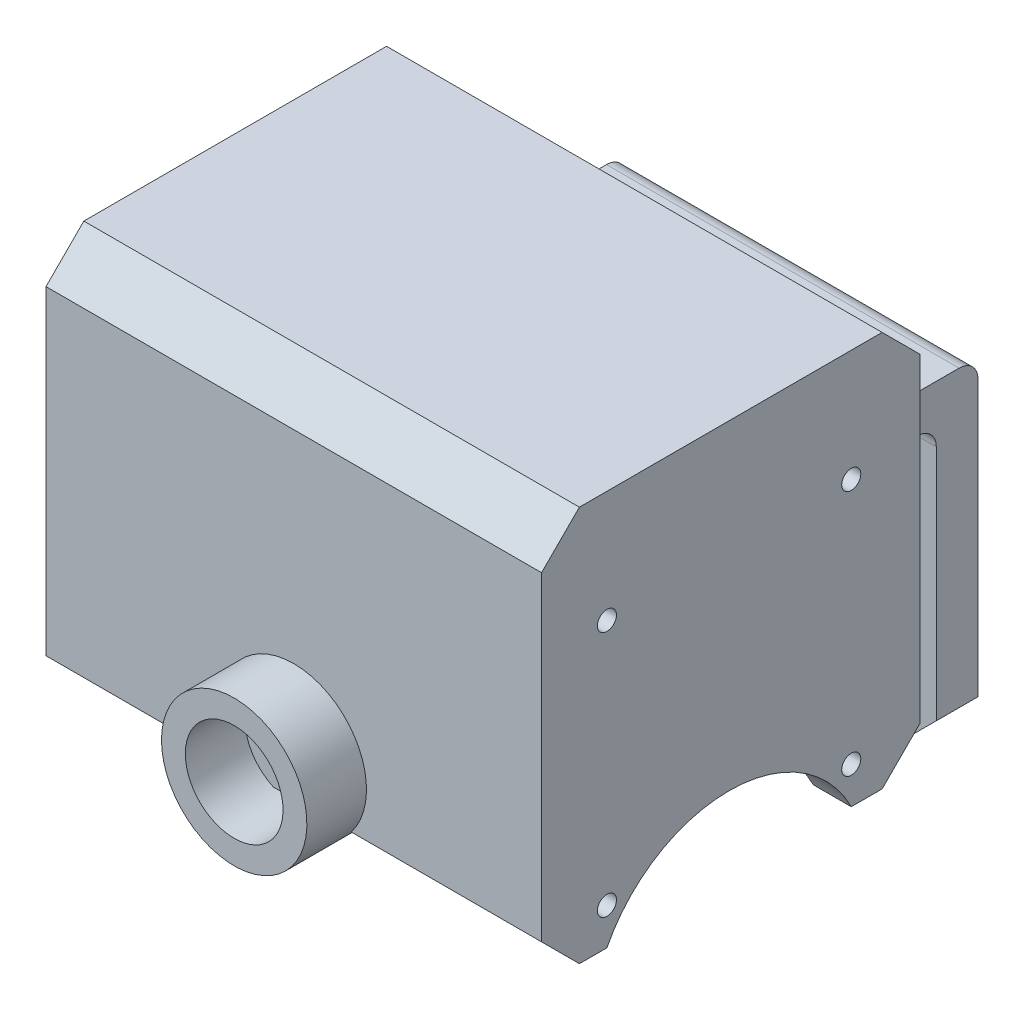
from build123d import *

# Parameters (mm, degrees)
SKETCH1_W                       = 25
SKETCH1_H                       = 30
BOSS_EXTRUDE1_DEPTH             = 3.175
SKETCH2_W                       = 25
SKETCH2_H                       = 3.175
BOSS_EXTRUDE2_DEPTH             = 41.58
SKETCH3_W                       = 3.175
SKETCH3_H                       = 25
BOSS_EXTRUDE3_DEPTH             = 30
CUT_EXTRUDE1_REACH              = 60.775
SKETCH4_R                       = 11.5
CUT_EXTRUDE2_REACH              = 60.775
SKETCH5_R                       = 0.8
CUT_EXTRUDE3_REACH              = 60.775
SKETCH6_R                       = 0.8
SKETCH6_R_2                     = 0.799851166
SKETCH6_W                       = 21.2
SKETCH6_H                       = 6.375
CUT_EXTRUDE4_REACH              = 60.775
SKETCH7_R                       = 11.5
BOSS_EXTRUDE4_DEPTH             = 0.2
SKETCH9_W                       = 41.58
SKETCH9_H                       = 33.175
BOSS_EXTRUDE5_DEPTH             = 3.175
BOSS_EXTRUDE6_DEPTH             = 0.2
SKETCH11_W                      = 41.58
SKETCH11_H                      = 33.175
BOSS_EXTRUDE7_DEPTH             = 3.175
CHAMFER1_SIZE                   = 3.175
CHAMFER2_SIZE                   = 3.175
SKETCH13_W                      = 29.58
SKETCH13_H                      = 3.175
BOSS_EXTRUDE8_DEPTH             = 7.695
BOSS_EXTRUDE9_REACH             = 59.968
SKETCH14_W                      = 29.58
SKETCH14_H                      = 3.5
BOSS_EXTRUDE9_DIRECTION_2_DEPTH = 25
CHAMFER3_SIZE                   = 3.5
FILLET1_R                       = 1.5875
FILLET2_R                       = 1.5875
CUT_EXTRUDE5_REACH              = 70.161
SKETCH16_R                      = 6.1
SKETCH20_R                      = 8
SKETCH20_R_2                    = 4.1
BOSS_EXTRUDE11_DEPTH            = 5
CUT_EXTRUDE6_START              = -21.7275
SKETCH21_R                      = 1.025
CUT_EXTRUDE6_DEPTH              = 16
BOSS_EXTRUDE12_DEPTH            = 5
BOSS_EXTRUDE12_DEPTH_BACK       = 1.2
SKETCH23_R                      = 6.1
SKETCH23_R_2                    = 4.1
CHAMFER4_SIZE                   = 1.5


with BuildPart() as part:
    # Sketch1 → Boss-Extrude1 (new body)
    with BuildSketch(Plane(origin=(0, 0, 0), x_dir=(0, 0, -1), z_dir=(1, 0, 0))):
        with Locations((12.5, 15)):
            Rectangle(SKETCH1_W, SKETCH1_H)
    extrude(amount=BOSS_EXTRUDE1_DEPTH)

    # Sketch2 → Boss-Extrude2 (add)
    with BuildSketch(Plane.ZY):
        with Locations((-12.5, 31.5875)):
            Rectangle(SKETCH2_W, SKETCH2_H)
    extrude(amount=-BOSS_EXTRUDE2_DEPTH)

    # Sketch3 → Boss-Extrude3 (add)
    with BuildSketch(Plane.XZ.offset(-30)):
        with Locations((39.9925, -12.5)):
            Rectangle(SKETCH3_W, SKETCH3_H)
    extrude(amount=BOSS_EXTRUDE3_DEPTH)

    # Sketch4 → Cut-Extrude1 (cut, up to next)
    with BuildSketch(Plane.ZY, mode=Mode.PRIVATE) as cut_extrude1_sk1:
        with Locations((-12.359999929, -5.209996254)):
            Circle(SKETCH4_R)
    cut_extrude1_tool1 = extrude(cut_extrude1_sk1.sketch, amount=-CUT_EXTRUDE1_REACH, mode=Mode.PRIVATE) & part.part
    add(cut_extrude1_tool1.solids().sort_by_distance((0, -5.209996, -12.36))[0], mode=Mode.SUBTRACT)

    # Sketch5 → Cut-Extrude2 (cut, up to next)
    with BuildSketch(Plane.ZY, mode=Mode.PRIVATE) as cut_extrude2_sk1:
        with Locations((-22.609999929, 3.090003746)):
            Circle(SKETCH5_R)
    cut_extrude2_tool1 = extrude(cut_extrude2_sk1.sketch, amount=-CUT_EXTRUDE2_REACH, mode=Mode.PRIVATE) & part.part
    # Sketch5 → Cut-Extrude2 (cut, up to next)
    with BuildSketch(Plane.ZY, mode=Mode.PRIVATE) as cut_extrude2_sk2:
        with Locations((-22.609999929, 23.790003746)):
            Circle(SKETCH5_R)
    cut_extrude2_tool2 = extrude(cut_extrude2_sk2.sketch, amount=-CUT_EXTRUDE2_REACH, mode=Mode.PRIVATE) & part.part
    # Sketch5 → Cut-Extrude2 (cut, up to next)
    with BuildSketch(Plane.ZY, mode=Mode.PRIVATE) as cut_extrude2_sk3:
        with Locations((-2.109999929, 23.790003746)):
            Circle(SKETCH5_R)
    cut_extrude2_tool3 = extrude(cut_extrude2_sk3.sketch, amount=-CUT_EXTRUDE2_REACH, mode=Mode.PRIVATE) & part.part
    # Sketch5 → Cut-Extrude2 (cut, up to next)
    with BuildSketch(Plane.ZY, mode=Mode.PRIVATE) as cut_extrude2_sk4:
        with Locations((-2.109999929, 3.090003746)):
            Circle(SKETCH5_R)
    cut_extrude2_tool4 = extrude(cut_extrude2_sk4.sketch, amount=-CUT_EXTRUDE2_REACH, mode=Mode.PRIVATE) & part.part
    add(cut_extrude2_tool1.solids().sort_by_distance((0, 3.090004, -22.61))[0], mode=Mode.SUBTRACT)
    add(cut_extrude2_tool2.solids().sort_by_distance((0, 23.790004, -22.61))[0], mode=Mode.SUBTRACT)
    add(cut_extrude2_tool3.solids().sort_by_distance((0, 23.790004, -2.11))[0], mode=Mode.SUBTRACT)
    add(cut_extrude2_tool4.solids().sort_by_distance((0, 3.090004, -2.11))[0], mode=Mode.SUBTRACT)

    # Sketch6 → Cut-Extrude3 (cut, up to next)
    with BuildSketch(Plane(origin=(41.58, 0, 0), x_dir=(0, 0, -1), z_dir=(1, 0, 0)), mode=Mode.PRIVATE) as cut_extrude3_sk1:
        with Locations(Location((2.109999929, 3.090003746, 0), (0, 0, 180))):
            Circle(SKETCH6_R)
    cut_extrude3_tool1 = extrude(cut_extrude3_sk1.sketch, amount=-CUT_EXTRUDE3_REACH, mode=Mode.PRIVATE) & part.part
    # Sketch6 → Cut-Extrude3 (cut, up to next)
    with BuildSketch(Plane(origin=(41.58, 0, 0), x_dir=(0, 0, -1), z_dir=(1, 0, 0)), mode=Mode.PRIVATE) as cut_extrude3_sk2:
        with Locations(Location((22.609999929, 3.090003746, 0), (0, 0, 180))):
            Circle(SKETCH6_R)
    cut_extrude3_tool2 = extrude(cut_extrude3_sk2.sketch, amount=-CUT_EXTRUDE3_REACH, mode=Mode.PRIVATE) & part.part
    # Sketch6 → Cut-Extrude3 (cut, up to next)
    with BuildSketch(Plane(origin=(41.58, 0, 0), x_dir=(0, 0, -1), z_dir=(1, 0, 0)), mode=Mode.PRIVATE) as cut_extrude3_sk3:
        with Locations((22.609999929, 27.540003746)):
            Circle(SKETCH6_R_2)
    cut_extrude3_tool3 = extrude(cut_extrude3_sk3.sketch, amount=-CUT_EXTRUDE3_REACH, mode=Mode.PRIVATE) & part.part
    # Sketch6 → Cut-Extrude3 (cut, up to next)
    with BuildSketch(Plane(origin=(41.58, 0, 0), x_dir=(0, 0, -1), z_dir=(1, 0, 0)), mode=Mode.PRIVATE) as cut_extrude3_sk4:
        with Locations((2.109999929, 27.540003746)):
            Circle(SKETCH6_R)
    cut_extrude3_tool4 = extrude(cut_extrude3_sk4.sketch, amount=-CUT_EXTRUDE3_REACH, mode=Mode.PRIVATE) & part.part
    # Sketch6 → Cut-Extrude3 (cut, up to next)
    with BuildSketch(Plane(origin=(41.58, 0, 0), x_dir=(0, 0, -1), z_dir=(1, 0, 0)), mode=Mode.PRIVATE) as cut_extrude3_sk5:
        with Locations((12.359999929, 8.927503746)):
            Rectangle(SKETCH6_W, SKETCH6_H)
    cut_extrude3_tool5 = extrude(cut_extrude3_sk5.sketch, amount=-CUT_EXTRUDE3_REACH, mode=Mode.PRIVATE) & part.part
    add(cut_extrude3_tool1.solids().sort_by_distance((41.58, 3.090004, -2.11))[0], mode=Mode.SUBTRACT)
    add(cut_extrude3_tool2.solids().sort_by_distance((41.58, 3.090004, -22.61))[0], mode=Mode.SUBTRACT)
    add(cut_extrude3_tool3.solids().sort_by_distance((41.58, 27.540004, -22.61))[0], mode=Mode.SUBTRACT)
    add(cut_extrude3_tool4.solids().sort_by_distance((41.58, 27.540004, -2.11))[0], mode=Mode.SUBTRACT)
    add(cut_extrude3_tool5.solids().sort_by_distance((41.58, 8.927504, -12.36))[0], mode=Mode.SUBTRACT)

    # Sketch7 → Cut-Extrude4 (cut, up to next)
    with BuildSketch(Plane(origin=(41.58, 0, 0), x_dir=(0, 0, -1), z_dir=(1, 0, 0)), mode=Mode.PRIVATE) as cut_extrude4_sk1:
        with Locations((12.359999929, -5.209996254)):
            Circle(SKETCH7_R)
    cut_extrude4_tool1 = extrude(cut_extrude4_sk1.sketch, amount=-CUT_EXTRUDE4_REACH, mode=Mode.PRIVATE) & part.part
    add(cut_extrude4_tool1.solids().sort_by_distance((41.58, -5.209996, -12.36))[0], mode=Mode.SUBTRACT)

    # Sketch8 → Boss-Extrude4 (add)
    with BuildSketch(Plane.XY):
        Polygon((0, 33.175), (0, 0), (3.175, 0), (3.175, 30), (38.405, 30), (38.405, 0), (41.58, 0), (41.58, 33.175), align=None)
    extrude(amount=BOSS_EXTRUDE4_DEPTH)

    # Sketch9 → Boss-Extrude5 (add)
    with BuildSketch(Plane.XY.offset(0.2)):
        with Locations((20.79, 16.5875)):
            Rectangle(SKETCH9_W, SKETCH9_H)
    extrude(amount=BOSS_EXTRUDE5_DEPTH)

    # Sketch10 → Boss-Extrude6 (add)
    with BuildSketch(Plane(origin=(0, 0, -25), x_dir=(-1, 0, 0), z_dir=(0, 0, -1))):
        Polygon((0, 0), (0, 33.175), (-41.58, 33.175), (-41.58, 0), (-38.405, 0), (-38.405, 30), (-3.175, 30), (-3.175, 0), align=None)
    extrude(amount=BOSS_EXTRUDE6_DEPTH)

    # Sketch11 → Boss-Extrude7 (add)
    with BuildSketch(Plane(origin=(0, 0, -25.2), x_dir=(-1, 0, 0), z_dir=(0, 0, -1))):
        with Locations((-20.79, 16.5875)):
            Rectangle(SKETCH11_W, SKETCH11_H)
    extrude(amount=BOSS_EXTRUDE7_DEPTH)

    # Chamfer1
    chamfer1_edges = [part.edges().sort_by_distance(p)[0] for p in [
        (20.79, 33.175, 3.375),
        (20.79, 33.175, -28.375),
    ]]
    chamfer(chamfer1_edges, length=CHAMFER1_SIZE)

    # Chamfer2
    chamfer2_edges = [part.edges().sort_by_distance(p)[0] for p in [
        (20.79, 0, 3.375),
        (20.79, 0, -28.375),
    ]]
    chamfer(chamfer2_edges, length=CHAMFER2_SIZE - 0.0001)  # a hair under: the kernel refuses the full size

    # Sketch13 → Boss-Extrude8 (add)
    with BuildSketch(Plane(origin=(0, 0, -28.375), x_dir=(-1, 0, 0), z_dir=(0, 0, -1))):
        with Locations((-20.79, 19.7625)):
            Rectangle(SKETCH13_W, SKETCH13_H)
    extrude(amount=BOSS_EXTRUDE8_DEPTH)

    # Boss-Extrude9: up to this face of the body (flat: up to its plane)
    boss_extrude9_end = Plane(part.part.faces().sort_by_distance((20.79, 21.35, -32.2225))[0])
    # Sketch14 → Boss-Extrude9 (add, up to the picked face)
    with BuildSketch(Plane.XZ.offset(-18.175), mode=Mode.PRIVATE) as boss_extrude9_sk1:
        with Locations((20.79, -37.495)):
            Rectangle(SKETCH14_W, SKETCH14_H)
    boss_extrude9_tool1 = split(extrude(boss_extrude9_sk1.sketch, amount=-BOSS_EXTRUDE9_REACH, mode=Mode.PRIVATE), bisect_by=boss_extrude9_end, keep=Keep.BOTH, mode=Mode.PRIVATE)
    add(boss_extrude9_tool1.solids().sort_by(Axis((20.79, 18.175, -37.495), (0, 1, 0)))[0])

    # Sketch14 → Boss-Extrude9 direction 2 (add)
    with BuildSketch(Plane.XZ.offset(-18.175)):
        with Locations((20.79, -37.495)):
            Rectangle(SKETCH14_W, SKETCH14_H)
    extrude(amount=BOSS_EXTRUDE9_DIRECTION_2_DEPTH)

    # Chamfer3
    chamfer3_edges = [part.edges().sort_by_distance(p)[0] for p in [
        (6, -6.825, -37.495),
        (35.58, -6.825, -37.495),
    ]]
    chamfer(chamfer3_edges, length=CHAMFER3_SIZE)

    # Fillet1
    fillet1_edges = [part.edges().sort_by_distance(p)[0] for p in [
        (20.79, 18.175, -35.745),
        (20.79, 21.35, -39.245),
    ]]
    fillet(fillet1_edges, radius=FILLET1_R)

    # Fillet2
    fillet2_edges = [part.edges().sort_by_distance(p)[0] for p in [
        (20.79, 21.35, -28.375),
    ]]
    fillet(fillet2_edges, radius=FILLET2_R)

    # Sketch16 → Cut-Extrude5 (cut, up to next)
    with BuildSketch(Plane(origin=(0, 0, -39.245), x_dir=(-1, 0, 0), z_dir=(0, 0, -1)), mode=Mode.PRIVATE) as cut_extrude5_sk1:
        with Locations((-20.79, 6.9025)):
            Circle(SKETCH16_R)
    cut_extrude5_tool1 = extrude(cut_extrude5_sk1.sketch, amount=-CUT_EXTRUDE5_REACH, mode=Mode.PRIVATE) & part.part
    add(cut_extrude5_tool1.solids().sort_by_distance((20.79, 6.9025, -39.245))[0], mode=Mode.SUBTRACT)

    # Sketch20 → Boss-Extrude11 (add)
    with BuildSketch(Plane.XY.offset(-35.745)):
        with Locations(Location((20.79, 6.9025, 0), (0, 0, 180))):
            Circle(SKETCH20_R)
        with Locations((20.79, 6.9025)):
            Circle(SKETCH20_R_2, mode=Mode.SUBTRACT)
    extrude(amount=BOSS_EXTRUDE11_DEPTH)

    # Sketch21 → Cut-Extrude6 (cut)
    with BuildSketch(Plane.XZ.offset(6.825).offset(CUT_EXTRUDE6_START)):
        with Locations(Location((20.79, -33.245, 0), (0, 0, 270))):
            Circle(SKETCH21_R)
    extrude(amount=CUT_EXTRUDE6_DEPTH, mode=Mode.SUBTRACT)

    # Sketch23 → Boss-Extrude12 (add, two sides: drawn at the far end of the back side and taken through both)
    with BuildSketch(Plane.XY.offset(3.375).offset(-BOSS_EXTRUDE12_DEPTH_BACK)):
        with Locations(Location((20.79, 6.9025, 0), (0, 0, 180))):
            Circle(SKETCH23_R)
        with Locations((20.79, 6.9025)):
            Circle(SKETCH23_R_2, mode=Mode.SUBTRACT)
    extrude(amount=BOSS_EXTRUDE12_DEPTH + BOSS_EXTRUDE12_DEPTH_BACK)

    # Chamfer4
    chamfer4_edges = [part.edges().sort_by_distance(p)[0] for p in [
        (35.58, 20.55625, -28.375),
        (20.79, 18.175, -28.375),
        (6, 20.55625, -28.375),
    ]]
    chamfer(chamfer4_edges, length=CHAMFER4_SIZE)


with BuildPart() as body_2:
    # Mirror1: mirrored copy
    add(part.part.mirror(Plane(origin=(51.58, 0, 0), x_dir=(0, 0, 1), z_dir=(1, 0, 0))))


solid = body_2.part
